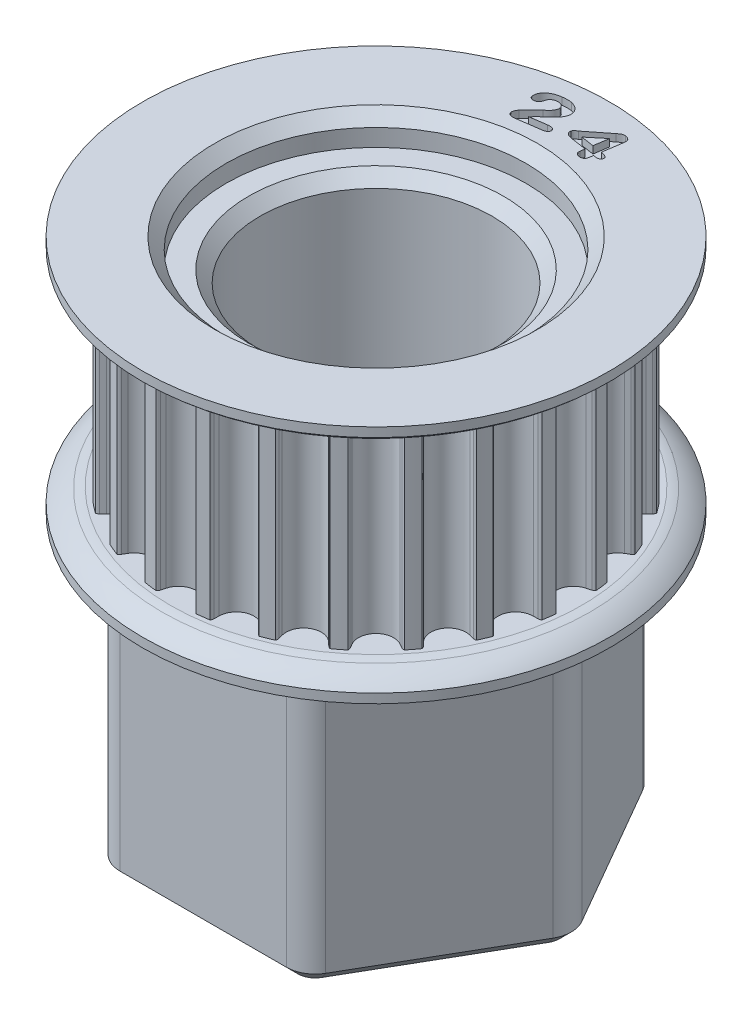
from build123d import *

# Parameters (mm, degrees)
SKETCH1_R                    = 11.078156269
TOOTHOD_DEPTH                = 5.334
TOOTHPROFILE_DEPTH           = 17.550004491
TOOTHPATTERN_COUNT           = 24
BORE_DEPTH                   = 20.343586122
BORE_DEPTH_BACK              = 20.343586122
SKETCH7_R                    = 6.3881
SMALL_TOOTH_COUNT_DEPTH      = 23.472489227
SMALL_TOOTH_COUNT_DEPTH_BACK = 0.4
SKETCH12_R                   = 6.3881
BOSS_EXTRUDE1_DEPTH          = 15.24
SKETCH27_R                   = 8.255
CUT_EXTRUDE1_DEPTH           = 1.5875
FILLET1_R                    = 1.5875
CUT_SWEEP1_PROFILE_R         = 0.3175
FILLET2_R                    = 1.27
CHAMFER1_SIZE                = 0.635
CHAMFER2_SIZE                = 0.635


with BuildPart() as part:
    # Sketch1 → ToothOD (new, symmetric)
    with BuildSketch(Plane(origin=(0, 0, 0), x_dir=(1, 0, 0), z_dir=(0, 1, 0))):
        Circle(SKETCH1_R)
    extrude(amount=TOOTHOD_DEPTH, both=True)

    # Sketch2 → ToothProfile (cut, symmetric)
    with BuildSketch(Plane(origin=(0, 0, 0), x_dir=(1, 0, 0), z_dir=(0, 1, 0))):
        with BuildLine():
            ThreePointArc((-0.937033068, 10.628218265), (-0.590385173, 10.110043655), (0, 9.909756269))
            ThreePointArc((0, 9.909756269), (0.590385173, 10.110043655), (0.937033068, 10.628218265))
            ThreePointArc((0.937033068, 10.628218265), (0.971699064, 10.754329727), (1.007805813, 10.880036269))
            ThreePointArc((1.007805813, 10.880036269), (1.043742495, 10.958436311), (1.100516181, 11.023357495))
            ThreePointArc((1.100516181, 11.023357495), (0, 11.078156269), (-1.100516181, 11.023357495))
            ThreePointArc((-1.100516181, 11.023357495), (-1.043742495, 10.958436311), (-1.007805813, 10.880036269))
            ThreePointArc((-1.007805813, 10.880036269), (-0.971699064, 10.754329727), (-0.937033068, 10.628218265))
        make_face()
    toothprofile = extrude(amount=TOOTHPROFILE_DEPTH, both=True, mode=Mode.SUBTRACT)

    # ToothPattern: ToothProfile ×24 about axis
    toothpattern_axis = Axis((0, 5.334, 0), (0, -1, 0))
    for i in range(1, TOOTHPATTERN_COUNT):
        add(toothprofile.rotate(toothpattern_axis, i * 360 / TOOTHPATTERN_COUNT), mode=Mode.SUBTRACT)

    # Sketch4 → Flange (revolve)
    with BuildSketch(Plane.XY):
        with BuildLine():
            Line((0, -5.334), (11.332156269, -5.334))
            ThreePointArc((11.332156269, -5.334), (11.56180289, -5.369951298), (11.787228598, -5.426637424))
            ThreePointArc((11.787228598, -5.426637424), (12.354957174, -5.708197125), (12.856156269, -6.096))
            Line((12.856156269, -6.096), (12.856156269, -6.604))
            Line((12.856156269, -6.604), (0, -6.604))
            Line((0, -6.604), (0, -5.334))
        make_face()
        with BuildLine():
            Line((12.856156269, 6.604), (12.856156269, 6.096))
            ThreePointArc((12.856156269, 6.096), (12.354957174, 5.708197125), (11.787228598, 5.426637424))
            ThreePointArc((11.787228598, 5.426637424), (11.56180289, 5.369951298), (11.332156269, 5.334))
            Line((11.332156269, 5.334), (0, 5.334))
            Line((0, 5.334), (0, 6.604))
            Line((0, 6.604), (12.856156269, 6.604))
        make_face()
    revolve(axis=Axis((0, 8.73125, 0), (0, -1, 0)))

    # Sketch7 → Bore (cut, two sides: drawn at the far end of the back side and taken through both)
    with BuildSketch(Plane.XZ.offset(-BORE_DEPTH_BACK)):
        Circle(SKETCH7_R)
    extrude(amount=BORE_DEPTH + BORE_DEPTH_BACK, mode=Mode.SUBTRACT)

    # Sketch11 → Small Tooth Count (cut, two sides: drawn at the far end of the back side and taken through both)
    # profile 1 of 2: a face of its own
    with BuildSketch(Plane(origin=(0, 6.604, 0), x_dir=(1, 0, 0), z_dir=(0, 1, 0)).offset(-SMALL_TOOTH_COUNT_DEPTH_BACK)):
        with BuildLine():
            Line((-1.50932721, 9.916837863), (-0.597606116, 10.046764816))
            add(Edge.make_bspline(
                [(-0.597606116, 10.046764816), (-0.571157489, 10.050105826), (-0.52120142, 10.056416311), (-0.449541333, 10.055313599), (-0.385667722, 10.047305308), (-0.330562884, 10.029277348), (-0.28444503, 10.005378402), (-0.249016623, 9.974662726), (-0.224075796, 9.938023746), (-0.217996356, 9.910169852), (-0.214969007, 9.896299582)],
                knots=[0, 0, 0, 0, 1.407436454, 2.658360686, 3.778686155, 4.796186387, 5.707822169, 6.504860125, 7.25547238, 8, 8, 8, 8], degree=3))
            add(Edge.make_bspline(
                [(-0.214969007, 9.896299582), (-0.213936308, 9.883603258), (-0.211851942, 9.857977408), (-0.222454605, 9.819456736), (-0.242047158, 9.78205115), (-0.270462476, 9.745517337), (-0.309742938, 9.712270871), (-0.360197484, 9.685833025), (-0.421026872, 9.665765439), (-0.465453114, 9.658287244), (-0.489110413, 9.654305051)],
                knots=[0, 0, 0, 0, 0.748192561, 1.510127746, 2.320859081, 3.236210595, 4.228876646, 5.33922549, 6.583118088, 8, 8, 8, 8], degree=3))
            Line((-0.489110413, 9.654305051), (-1.858031507, 9.458744894))
            add(Edge.make_bspline(
                [(-1.858031507, 9.458744894), (-1.881812164, 9.456078685), (-1.927114595, 9.450999526), (-1.992824891, 9.455151256), (-2.052190696, 9.468165459), (-2.104274077, 9.490978722), (-2.147742871, 9.521062832), (-2.181559921, 9.557126937), (-2.205078512, 9.598853341), (-2.211523929, 9.629488347), (-2.214772522, 9.644928879)],
                knots=[0, 0, 0, 0, 1.281292524, 2.440877223, 3.513557772, 4.524978182, 5.470507004, 6.329058183, 7.157818661, 8, 8, 8, 8], degree=3))
            add(Edge.make_bspline(
                [(-2.214772522, 9.644928879), (-2.215569805, 9.655797352), (-2.217301044, 9.679397428), (-2.212074679, 9.717481484), (-2.200960176, 9.760321538), (-2.184255907, 9.806310122), (-2.16419242, 9.852762198), (-2.140750929, 9.895489886), (-2.116593563, 9.93417597), (-2.097617179, 9.956478399), (-2.088417444, 9.967290597)],
                knots=[0, 0, 0, 0, 0.737310593, 1.601014737, 2.589839704, 3.735717173, 4.915099845, 6.016891089, 7.038590449, 8, 8, 8, 8], degree=3))
            add(Edge.make_bspline(
                [(-2.088417444, 9.967290597), (-2.052954712, 10.006233814), (-1.984101455, 10.081844663), (-1.882231331, 10.190148309), (-1.78600669, 10.290828012), (-1.70863357, 10.368561764), (-1.650073949, 10.425787839), (-1.610218762, 10.464524742), (-1.573038245, 10.499377239), (-1.539092018, 10.530615679), (-1.508517118, 10.558426697), (-1.480481045, 10.581976657), (-1.45629526, 10.602878662), (-1.440339068, 10.614629857), (-1.432978382, 10.620050754)],
                knots=[0, 0, 0, 0, 2.047788947, 3.975918602, 5.780698357, 7.462358793, 8.239809494, 8.964130096, 9.62319837, 10.221078995, 10.757845781, 11.229820742, 11.644711727, 12, 12, 12, 12], degree=3))
            add(Edge.make_bspline(
                [(-1.432978382, 10.620050754), (-1.411114208, 10.637295005), (-1.368791421, 10.670674943), (-1.309585205, 10.721861713), (-1.257517254, 10.773066677), (-1.210534252, 10.82242143), (-1.17028345, 10.87179307), (-1.135606303, 10.920131703), (-1.107860743, 10.968292082), (-1.08553367, 11.015174114), (-1.069936386, 11.061387106), (-1.059705317, 11.105925046), (-1.056275295, 11.149162831), (-1.058881911, 11.176977588), (-1.060163929, 11.190657785)],
                knots=[0, 0, 0, 0, 1.41082819, 2.730959837, 3.962766903, 5.109764772, 6.181493254, 7.187824709, 8.120338862, 8.994079246, 9.814383323, 10.586481619, 11.304785934, 12, 12, 12, 12], degree=3))
            add(Edge.make_bspline(
                [(-1.060163929, 11.190657785), (-1.062618629, 11.204494899), (-1.06747002, 11.231842127), (-1.083834468, 11.270115654), (-1.105489401, 11.305625195), (-1.133408735, 11.337522246), (-1.166046845, 11.366425296), (-1.203892765, 11.390361143), (-1.245966118, 11.410353932), (-1.292161897, 11.424992006), (-1.340996369, 11.435882109), (-1.391906039, 11.441117217), (-1.44430733, 11.441309423), (-1.479439833, 11.437047814), (-1.497272132, 11.434884738)],
                knots=[0, 0, 0, 0, 0.906920493, 1.792408525, 2.674642041, 3.589913914, 4.525093507, 5.487027952, 6.478087552, 7.532080477, 8.616620183, 9.711251621, 10.838293888, 12, 12, 12, 12], degree=3))
            add(Edge.make_bspline(
                [(-1.497272132, 11.434884738), (-1.514165051, 11.431956836), (-1.547305706, 11.426212856), (-1.594999107, 11.41181417), (-1.63941231, 11.392475804), (-1.680884552, 11.368710631), (-1.719132889, 11.340057857), (-1.753507144, 11.305976261), (-1.785597804, 11.268097526), (-1.803721896, 11.239846839), (-1.812936585, 11.225483566)],
                knots=[0, 0, 0, 0, 1.047578806, 2.055147905, 3.037331254, 4.003491932, 4.971707363, 5.949835577, 6.957651196, 8, 8, 8, 8], degree=3))
            add(Edge.make_bspline(
                [(-1.812936585, 11.225483566), (-1.814458795, 11.221775606), (-1.819020173, 11.210664523), (-1.826430513, 11.187392943), (-1.8363605, 11.151981445), (-1.848825896, 11.106904921), (-1.864197864, 11.057785769), (-1.883498509, 11.010024351), (-1.907843305, 10.967140907), (-1.933918105, 10.926754831), (-1.968424595, 10.891810149), (-2.013254557, 10.864955698), (-2.067652355, 10.844897277), (-2.107752263, 10.83772542), (-2.129047522, 10.833916769)],
                knots=[0, 0, 0, 0, 0.265007539, 0.794108009, 1.613373207, 2.697617163, 3.886602221, 5.01617726, 6.095451393, 7.143719409, 8.187635248, 9.310199435, 10.571567743, 12, 12, 12, 12], degree=3))
            add(Edge.make_bspline(
                [(-2.129047522, 10.833916769), (-2.145702833, 10.832148904), (-2.177842142, 10.828737501), (-2.225347998, 10.833205546), (-2.269895483, 10.844047702), (-2.310724724, 10.862888812), (-2.346516666, 10.888526805), (-2.374439978, 10.921981153), (-2.393798514, 10.962258671), (-2.399679354, 10.991777532), (-2.402742444, 11.007152707)],
                knots=[0, 0, 0, 0, 1.103853878, 2.130077396, 3.133877759, 4.119166359, 5.082634088, 6.017851916, 6.96757965, 8, 8, 8, 8], degree=3))
            add(Edge.make_bspline(
                [(-2.402742444, 11.007152707), (-2.404621818, 11.025443769), (-2.408440344, 11.062607704), (-2.404036406, 11.119951061), (-2.393382933, 11.179126415), (-2.374872021, 11.239758118), (-2.349177564, 11.300687215), (-2.315494278, 11.36032443), (-2.273763975, 11.417744069), (-2.225138897, 11.473717212), (-2.168189831, 11.527075519), (-2.102387044, 11.576589749), (-2.02866634, 11.622983283), (-1.946451016, 11.665537987), (-1.855893746, 11.703375453), (-1.756635021, 11.735560403), (-1.648939306, 11.761335845), (-1.573863538, 11.773374554), (-1.535223304, 11.779570676)],
                knots=[0, 0, 0, 0, 0.686667313, 1.395176401, 2.14217196, 2.933050997, 3.761378171, 4.611517609, 5.489179995, 6.412591937, 7.381608954, 8.40276096, 9.488705709, 10.636721208, 11.862062126, 13.156195851, 14.536341884, 16, 16, 16, 16], degree=3))
            add(Edge.make_bspline(
                [(-1.535223304, 11.779570676), (-1.51098446, 11.782864739), (-1.463484936, 11.789319934), (-1.3931866, 11.795965108), (-1.325279482, 11.800104771), (-1.259746788, 11.801309567), (-1.196738069, 11.800639843), (-1.136249357, 11.797045796), (-1.078284928, 11.79091863), (-1.0406437, 11.784799376), (-1.022212757, 11.781803097)],
                knots=[0, 0, 0, 0, 1.139510729, 2.233036297, 3.288782861, 4.308228055, 5.285958018, 6.223630361, 7.130204615, 8, 8, 8, 8], degree=3))
            add(Edge.make_bspline(
                [(-1.022212757, 11.781803097), (-0.996346238, 11.776001966), (-0.945668387, 11.764636353), (-0.873068597, 11.740276391), (-0.805417719, 11.710781694), (-0.742751011, 11.676450968), (-0.685656039, 11.637533154), (-0.633786844, 11.595223091), (-0.58870652, 11.54841819), (-0.54906255, 11.498825501), (-0.516177347, 11.446357641), (-0.489829112, 11.391805019), (-0.470755505, 11.33520861), (-0.463644085, 11.296287026), (-0.460088929, 11.276829269)],
                knots=[0, 0, 0, 0, 1.184878925, 2.321422417, 3.418236948, 4.481667666, 5.511750754, 6.504540555, 7.469430236, 8.412213537, 9.339242204, 10.232319117, 11.116297388, 12, 12, 12, 12], degree=3))
            add(Edge.make_bspline(
                [(-0.460088929, 11.276829269), (-0.458344915, 11.26151817), (-0.454881571, 11.231112681), (-0.454228176, 11.185416025), (-0.456587369, 11.139957574), (-0.463987312, 11.095046809), (-0.474807198, 11.050442291), (-0.489144725, 11.006067202), (-0.507281058, 10.961900847), (-0.537254061, 10.905276357), (-0.576759476, 10.838655761), (-0.626292967, 10.765363592), (-0.676992982, 10.701276091), (-0.722071621, 10.653855546), (-0.761194236, 10.617845627), (-0.794206933, 10.586849676), (-0.832065984, 10.552066211), (-0.87505434, 10.51382363), (-0.922365044, 10.471389469), (-0.974062376, 10.42482995), (-1.030912184, 10.37483785), (-1.091062336, 10.322368683), (-1.150688874, 10.269172522), (-1.207256163, 10.218149043), (-1.258914453, 10.170234867), (-1.305402401, 10.125022937), (-1.347010294, 10.083115848), (-1.383776929, 10.044108725), (-1.415868177, 10.008409704), (-1.434851705, 9.9849262), (-1.443694007, 9.973987863)],
                knots=[0, 0, 0, 0, 0.764715832, 1.518608056, 2.266281531, 3.021946302, 3.774714963, 4.543561344, 5.335395795, 6.141819471, 7.722191955, 9.179477286, 10.530900026, 11.774914819, 12.423188144, 13.170861619, 14.023369367, 14.975807079, 16.027662526, 17.178935749, 18.430237895, 19.786500845, 21.142119432, 22.397756293, 23.568968093, 24.640267795, 25.617411505, 26.500872375, 27.301724132, 28, 28, 28, 28], degree=3))
            add(Edge.make_bspline(
                [(-1.443694007, 9.973987863), (-1.453364212, 9.963671779), (-1.47330175, 9.942402602), (-1.497081325, 9.925527908), (-1.50932721, 9.916837863)],
                knots=[0, 0, 0, 0, 0.970050127, 2, 2, 2, 2], degree=3))
        make_face()
    # profile 2 of 2: a face of its own
    with BuildSketch(Plane(origin=(0, 6.604, 0), x_dir=(1, 0, 0), z_dir=(0, 1, 0)).offset(-SMALL_TOOTH_COUNT_DEPTH_BACK)):
        with BuildLine():
            Line((1.54875845, 9.694357822), (1.584923685, 9.933226963))
            Line((1.584923685, 9.933226963), (0.682132279, 10.069851181))
            add(Edge.make_bspline(
                [(0.682132279, 10.069851181), (0.667069888, 10.072365675), (0.637833552, 10.077246347), (0.59577177, 10.087058213), (0.55695217, 10.098786908), (0.52087805, 10.111393675), (0.488418367, 10.126838621), (0.458477124, 10.143111023), (0.432269492, 10.162056812), (0.408693626, 10.18212698), (0.38870757, 10.203944717), (0.371885868, 10.226994313), (0.35840571, 10.251290566), (0.348018344, 10.276733106), (0.341320451, 10.303508094), (0.337827643, 10.331370309), (0.337171075, 10.360614092), (0.339714529, 10.380324227), (0.341018216, 10.390426963)],
                knots=[0, 0, 0, 0, 1.388781889, 2.695647554, 3.924835582, 5.076755441, 6.166884665, 7.191145902, 8.171528826, 9.102438726, 10.003031995, 10.85597153, 11.692204285, 12.524262991, 13.348354993, 14.194608087, 15.074618352, 16, 16, 16, 16], degree=3))
            add(Edge.make_bspline(
                [(0.341018216, 10.390426963), (0.343314029, 10.401766071), (0.347905655, 10.424444287), (0.364951704, 10.456369439), (0.388568217, 10.486709873), (0.418275625, 10.515685703), (0.450792773, 10.54325826), (0.483165479, 10.570045891), (0.516726241, 10.593594233), (0.541010266, 10.605208787), (0.553098294, 10.610990244)],
                knots=[0, 0, 0, 0, 0.874989528, 1.749979056, 2.718094681, 3.789673942, 4.896134263, 5.957640263, 6.983360329, 8, 8, 8, 8], degree=3))
            Line((0.553098294, 10.610990244), (1.705027982, 11.518692978))
            add(Edge.make_bspline(
                [(1.705027982, 11.518692978), (1.723363136, 11.532991398), (1.757949305, 11.559962949), (1.808225363, 11.595384396), (1.852746903, 11.624819107), (1.892637113, 11.648787092), (1.932025804, 11.666045934), (1.973483961, 11.675129197), (2.017493428, 11.678705146), (2.047351945, 11.6750505), (2.062661966, 11.673176572)],
                knots=[0, 0, 0, 0, 1.385215562, 2.61297499, 3.66319543, 4.565137817, 5.383713486, 6.211887483, 7.083141318, 8, 8, 8, 8], degree=3))
            add(Edge.make_bspline(
                [(2.062661966, 11.673176572), (2.076257006, 11.671040484), (2.102449413, 11.666925065), (2.139810345, 11.656941366), (2.174575329, 11.646872817), (2.206120926, 11.633628939), (2.234672364, 11.618826973), (2.260956403, 11.602999155), (2.283731023, 11.58450638), (2.303810023, 11.564346874), (2.320102009, 11.541778551), (2.334314126, 11.518050763), (2.345011256, 11.492131061), (2.353022598, 11.464600848), (2.358015704, 11.435084984), (2.359498037, 11.403817064), (2.358831026, 11.370632185), (2.355784412, 11.348116563), (2.354216263, 11.336527353)],
                knots=[0, 0, 0, 0, 1.293804893, 2.49266397, 3.63541932, 4.696405976, 5.704707744, 6.66060036, 7.576904144, 8.458193591, 9.329188293, 10.188967274, 11.054995144, 11.959019234, 12.88214529, 13.86394316, 14.900531759, 16, 16, 16, 16], degree=3))
            Line((2.354216263, 11.336527353), (2.1845522, 10.222102353))
            Line((2.1845522, 10.222102353), (2.207322904, 10.218530478))
            add(Edge.make_bspline(
                [(2.207322904, 10.218530478), (2.232248392, 10.214268879), (2.280202022, 10.206070076), (2.348269361, 10.188595146), (2.409795368, 10.167787516), (2.456229433, 10.147023934), (2.48888784, 10.127893843), (2.509196551, 10.111682906), (2.526056243, 10.093814855), (2.538824571, 10.073635644), (2.547904264, 10.051594759), (2.552635086, 10.027515392), (2.554062763, 10.001786493), (2.552120748, 9.984263558), (2.551115872, 9.975196494)],
                knots=[0, 0, 0, 0, 1.927642278, 3.708550971, 5.352300247, 6.875759797, 7.578383738, 8.232399134, 8.850783688, 9.442669577, 10.04330382, 10.657613479, 11.305395775, 12, 12, 12, 12], degree=3))
            add(Edge.make_bspline(
                [(2.551115872, 9.975196494), (2.547955126, 9.96102685), (2.541797823, 9.933423624), (2.517793864, 9.897447274), (2.483869765, 9.869057778), (2.439811976, 9.848735526), (2.387159558, 9.83647943), (2.326366538, 9.831010515), (2.257659441, 9.832569738), (2.209510712, 9.838837208), (2.184105716, 9.84214415)],
                knots=[0, 0, 0, 0, 0.796932365, 1.552466999, 2.340640896, 3.216672216, 4.208643632, 5.316555866, 6.584118596, 8, 8, 8, 8], degree=3))
            Line((2.184105716, 9.84214415), (2.127848685, 9.850627353))
            Line((2.127848685, 9.850627353), (2.09168345, 9.611758213))
            add(Edge.make_bspline(
                [(2.09168345, 9.611758213), (2.087915831, 9.593695487), (2.080686946, 9.559038758), (2.05877288, 9.511463546), (2.027421046, 9.471942372), (1.987626923, 9.440800936), (1.941248649, 9.417609853), (1.888057705, 9.405099886), (1.829490591, 9.400928089), (1.789087064, 9.405679459), (1.767982279, 9.408161338)],
                knots=[0, 0, 0, 0, 1.023598687, 1.96396612, 2.882860389, 3.801754658, 4.752874875, 5.742353606, 6.820718238, 8, 8, 8, 8], degree=3))
            add(Edge.make_bspline(
                [(1.767982279, 9.408161338), (1.749936329, 9.411515451), (1.715051993, 9.417999234), (1.667376192, 9.438251786), (1.625447447, 9.464339438), (1.590867277, 9.497992309), (1.564133216, 9.53845956), (1.54803808, 9.585677285), (1.542213237, 9.638713459), (1.54650315, 9.675184309), (1.54875845, 9.694357822)],
                knots=[0, 0, 0, 0, 1.075850784, 2.079709954, 3.02358972, 3.963774271, 4.892949688, 5.847308372, 6.868283553, 8, 8, 8, 8], degree=3))
        make_face()
        Polygon((0.929484622, 10.412751181), (1.6416272, 10.304701963), (1.763517435, 11.104801963), align=None, mode=Mode.SUBTRACT)
    extrude(amount=SMALL_TOOTH_COUNT_DEPTH + SMALL_TOOTH_COUNT_DEPTH_BACK, mode=Mode.SUBTRACT)

    # Sketch12 → Boss-Extrude1 (add)
    with BuildSketch(Plane.XZ.offset(6.604)):
        Polygon((5.499261314, -9.525), (10.998522628, 0), (5.499261314, 9.525), (-5.499261314, 9.525), (-10.998522628, 0), (-5.499261314, -9.525), align=None)
        Circle(SKETCH12_R, mode=Mode.SUBTRACT)
    extrude(amount=BOSS_EXTRUDE1_DEPTH)

    # Sketch27 → Cut-Extrude1 (cut)
    with BuildSketch(Plane(origin=(0, 6.604, 0), x_dir=(1, 0, 0), z_dir=(0, 1, 0))):
        Circle(SKETCH27_R)
    extrude(amount=-CUT_EXTRUDE1_DEPTH, mode=Mode.SUBTRACT)

    # Fillet1
    fillet1_edges = [part.edges().sort_by_distance(p)[0] for p in [
        (-5.499261314, -14.224, 9.525),
        (5.499261314, -14.224, 9.525),
        (10.998522628, -14.224, 0),
        (5.499261314, -14.224, -9.525),
        (-10.998522628, -14.224, 0),
        (-5.499261314, -14.224, -9.525),
    ]]
    fillet(fillet1_edges, radius=FILLET1_R)

    # Cut-Sweep1: sweep along a path in Sketch25
    with BuildLine(Plane.XZ.offset(6.604)) as cut_sweep1_path:
        Line((-4.582717762, -9.525), (4.582717762, -9.525))
        ThreePointArc((4.582717762, -9.525), (5.376467762, -9.312315329), (5.95753309, -8.73125))
        Line((5.95753309, -8.73125), (10.540250852, -0.79375))
        ThreePointArc((10.540250852, -0.79375), (10.752935523, 0), (10.540250852, 0.79375))
        Line((10.540250852, 0.79375), (5.95753309, 8.73125))
        ThreePointArc((5.95753309, 8.73125), (5.376467762, 9.312315329), (4.582717762, 9.525))
        Line((4.582717762, 9.525), (-4.582717762, 9.525))
        ThreePointArc((-4.582717762, 9.525), (-5.376467762, 9.312315329), (-5.95753309, 8.73125))
        Line((-5.95753309, 8.73125), (-10.540250852, 0.79375))
        ThreePointArc((-10.540250852, 0.79375), (-10.752935523, 0), (-10.540250852, -0.79375))
        Line((-10.540250852, -0.79375), (-5.95753309, -8.73125))
        ThreePointArc((-5.95753309, -8.73125), (-5.376467762, -9.312315329), (-4.582717762, -9.525))
    # Cut-Sweep1 profile (on start of the path) → Cut-Sweep1 (sweep, cut)
    with BuildSketch(Plane(origin=(-4.582717762, -6.604, -9.525), x_dir=(0, 0, 1), z_dir=(1, 0, 0))):
        Circle(CUT_SWEEP1_PROFILE_R)
    sweep(path=cut_sweep1_path.line, mode=Mode.SUBTRACT)

    # Fillet2
    fillet2_edges = [part.edges().sort_by_distance(p)[0] for p in [
        (-5.535217762, -6.604, 9.587278394),
        (0, -6.604, 9.8425),
        (5.535217762, -6.604, 9.587278394),
        (8.523855037, -6.604, 4.92125),
        (11.070435523, -6.604, 0),
        (8.523855037, -6.604, -4.92125),
        (5.535217762, -6.604, -9.587278394),
        (0, -6.604, -9.8425),
        (-5.535217762, -6.604, -9.587278394),
        (-8.523855037, -6.604, -4.92125),
        (-11.070435523, -6.604, 0),
        (-10.752935523, -6.9215, 0),
        (-8.248891971, -6.9215, -4.7625),
        (-5.376467762, -6.9215, -9.312315329),
        (0, -6.9215, -9.525),
        (5.376467762, -6.9215, -9.312315329),
        (8.248891971, -6.9215, -4.7625),
        (10.752935523, -6.9215, 0),
        (8.248891971, -6.9215, 4.7625),
        (5.376467762, -6.9215, 9.312315329),
        (0, -6.9215, 9.525),
        (-5.376467762, -6.9215, 9.312315329),
        (-8.523855037, -6.604, 4.92125),
        (-8.248891971, -6.9215, 4.7625),
    ]]
    fillet(fillet2_edges, radius=FILLET2_R)

    # Chamfer1
    chamfer1_edges = [part.edges().sort_by_distance(p)[0] for p in [
        (-6.3881, -21.844, 0),
        (-8.255, 6.604, 0),
        (-6.3881, 5.0165, 0),
    ]]
    chamfer(chamfer1_edges, length=CHAMFER1_SIZE)

    # Chamfer2
    chamfer2_edges = [part.edges().sort_by_distance(p)[0] for p in [
        (0, -21.844, -9.525),
        (5.376467762, -21.844, -9.312315329),
        (-5.376467762, -21.844, -9.312315329),
        (8.248891971, -21.844, -4.7625),
        (-8.248891971, -21.844, -4.7625),
        (10.752935523, -21.844, 0),
        (-10.752935523, -21.844, 0),
        (8.248891971, -21.844, 4.7625),
        (-8.248891971, -21.844, 4.7625),
        (5.376467762, -21.844, 9.312315329),
        (-5.376467762, -21.844, 9.312315329),
        (0, -21.844, 9.525),
    ]]
    chamfer(chamfer2_edges, length=CHAMFER2_SIZE)


solid = part.part
